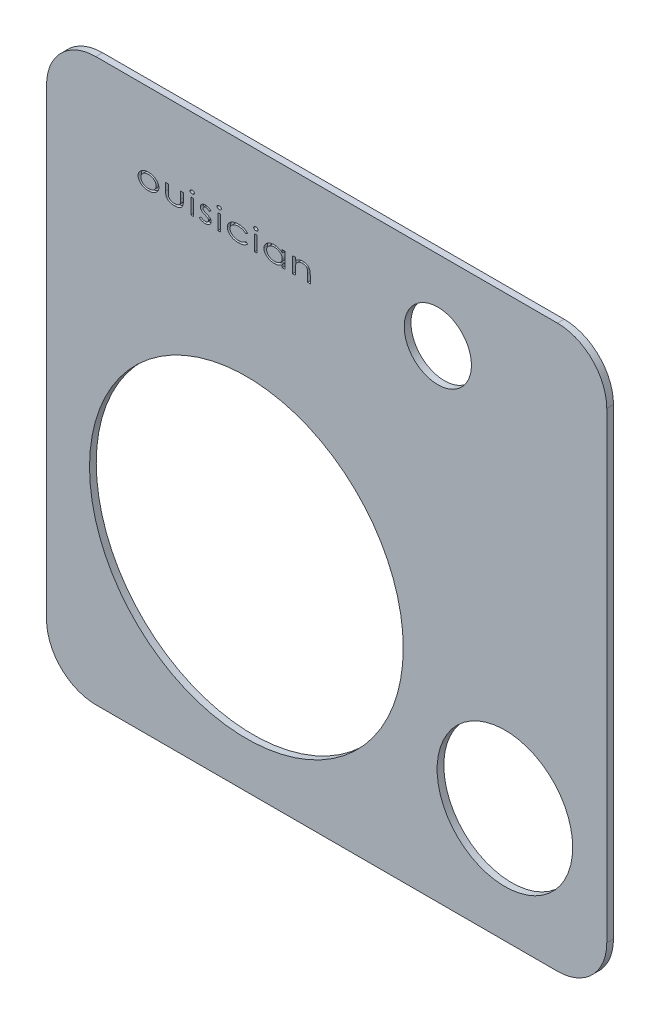
from build123d import *

# Parameters (mm, degrees)
SKETCH1_W           = 500
SKETCH1_H           = 501
BOSS_EXTRUDE1_DEPTH = 6
FILLET1_R           = 44
SKETCH3_R           = 140
CUT_EXTRUDE2_DEPTH  = 708.839671112
SKETCH5_R           = 60.5
CUT_EXTRUDE3_DEPTH  = 708.839671112
SKETCH6_R           = 30
CUT_EXTRUDE5_DEPTH  = 708.839671112
SKETCH7_W           = 2.442307693
SKETCH7_H           = 13.921153846
CUT_EXTRUDE6_DEPTH  = 3


with BuildPart() as part:
    # Sketch1 → Boss-Extrude1 (new body)
    with BuildSketch(Plane.XY):
        with Locations((250, 250.5)):
            Rectangle(SKETCH1_W, SKETCH1_H)
    extrude(amount=BOSS_EXTRUDE1_DEPTH)

    # Fillet1
    fillet1_edges = [part.edges().sort_by_distance(p)[0] for p in [
        (0, 0, 3),
        (500, 0, 3),
        (0, 501, 3),
        (500, 501, 3),
    ]]
    fillet(fillet1_edges, radius=FILLET1_R)

    # Sketch3 → Cut-Extrude2 (cut, through all)
    with BuildSketch(Plane.XY.offset(6)):
        with Locations((178.369044072, 181.034738009)):
            Circle(SKETCH3_R)
    extrude(amount=-CUT_EXTRUDE2_DEPTH, mode=Mode.SUBTRACT)

    # Sketch5 → Cut-Extrude3 (cut, through all)
    with BuildSketch(Plane.XY.offset(6)):
        with Locations((409.103373264, 102.516190165)):
            Circle(SKETCH5_R)
    extrude(amount=-CUT_EXTRUDE3_DEPTH, mode=Mode.SUBTRACT)

    # Sketch6 → Cut-Extrude5 (cut, through all)
    with BuildSketch(Plane.XY.offset(6)):
        with Locations((349.228645131, 430)):
            Circle(SKETCH6_R)
    extrude(amount=-CUT_EXTRUDE5_DEPTH, mode=Mode.SUBTRACT)

    # Sketch7 → Cut-Extrude6 (cut)
    # profile 1 of 12: a face of its own
    with BuildSketch(Plane.XY.offset(6)):
        with BuildLine():
            add(Edge.make_bspline(
                [(90.998016827, 435.165384615), (91.33416584, 435.159759711), (91.993114533, 435.148733283), (92.957647142, 435.033659522), (93.878731764, 434.854379203), (94.758576359, 434.610502452), (95.590807464, 434.281465913), (96.380304595, 433.888600418), (97.127424202, 433.422652341), (97.584251371, 433.055978048), (97.813581731, 432.871905048)],
                knots=[0, 0, 0, 0, 1.097812022, 2.152027136, 3.168404786, 4.161715094, 5.13027777, 6.087458756, 7.039891229, 8, 8, 8, 8], degree=3))
            add(Edge.make_bspline(
                [(97.813581731, 432.871905048), (98.009335824, 432.697597191), (98.392274771, 432.356611897), (98.891710147, 431.793239054), (99.316575043, 431.208138893), (99.66858563, 430.60001305), (99.933961044, 429.962255918), (100.133025282, 429.304789859), (100.249393064, 428.621087473), (100.263850563, 428.156901759), (100.271153846, 427.922415865)],
                knots=[0, 0, 0, 0, 1.100397171, 2.152623868, 3.155292484, 4.134298437, 5.097038208, 6.050627981, 7.015264311, 8, 8, 8, 8], degree=3))
            add(Edge.make_bspline(
                [(100.271153846, 427.922415865), (100.262985923, 427.686557594), (100.246803842, 427.219281241), (100.1202656, 426.531080976), (99.916228441, 425.865485142), (99.63385079, 425.220505043), (99.260671557, 424.60290329), (98.813568578, 424.005599519), (98.279994464, 423.434540306), (97.675345445, 422.891260476), (97.008952386, 422.388722838), (96.285916731, 421.951769806), (95.517972855, 421.581359249), (94.702493985, 421.278996347), (93.842045635, 421.042209306), (92.934251712, 420.875822948), (91.981022296, 420.775452484), (91.330265925, 420.762422035), (90.998016827, 420.755769231)],
                knots=[0, 0, 0, 0, 0.870154496, 1.723927757, 2.573468785, 3.435401244, 4.31551868, 5.231091511, 6.184642541, 7.19533158, 8.228285543, 9.260599047, 10.308491124, 11.370748216, 12.466552481, 13.59834036, 14.773812624, 16, 16, 16, 16], degree=3))
            add(Edge.make_bspline(
                [(90.998016827, 420.755769231), (90.664493287, 420.76241158), (90.011194252, 420.775422478), (89.054210098, 420.875958584), (88.143652313, 421.041541101), (87.281161889, 421.279908639), (86.463621281, 421.580248698), (85.694258277, 421.952957265), (84.96868676, 422.387649146), (84.301792525, 422.890114239), (83.70067732, 423.435825478), (83.167063326, 424.005450714), (82.720132305, 424.602940815), (82.346909523, 425.220495379), (82.064543119, 425.865487666), (81.86050301, 426.531080304), (81.733965548, 427.219281413), (81.717783361, 427.686557652), (81.709615385, 427.922415865)],
                knots=[0, 0, 0, 0, 1.22942661, 2.408175501, 3.543238373, 4.637748882, 5.703147586, 6.749802472, 7.784910086, 8.816644496, 9.822659333, 10.775084556, 11.68957642, 12.568654749, 13.429569571, 14.278107592, 15.130872849, 16, 16, 16, 16], degree=3))
            add(Edge.make_bspline(
                [(81.709615385, 427.922415865), (81.716972911, 428.155627291), (81.731577059, 428.618534746), (81.847825222, 429.300950344), (82.046158974, 429.957402835), (82.311971256, 430.592701804), (82.666655842, 431.197566542), (83.086349343, 431.78522194), (83.590076772, 432.345056297), (83.9717293, 432.685898823), (84.1671875, 432.860456731)],
                knots=[0, 0, 0, 0, 0.981183182, 1.947576142, 2.902902428, 3.862464617, 4.838610501, 5.847446984, 6.897598975, 8, 8, 8, 8], degree=3))
            add(Edge.make_bspline(
                [(84.1671875, 432.860456731), (84.39630701, 433.046103769), (84.852113943, 433.415427217), (85.602419416, 433.880887827), (86.392660465, 434.278984537), (87.228615071, 434.603728856), (88.107303242, 434.856998991), (89.030960896, 435.033027114), (89.999066043, 435.1488953), (90.660580728, 435.159814681), (90.998016827, 435.165384615)],
                knots=[0, 0, 0, 0, 0.960071228, 1.909951369, 2.870129955, 3.839957568, 4.827757854, 5.845479687, 6.900987469, 8, 8, 8, 8], degree=3))
        make_face()
        with BuildLine():
            add(Edge.make_bspline(
                [(90.990384615, 433.455769231), (90.759931849, 433.450534468), (90.306646767, 433.440238042), (89.64046147, 433.36208309), (88.999836122, 433.236197517), (88.382251754, 433.061361552), (87.789245332, 432.830524905), (87.219390762, 432.551855546), (86.673969115, 432.222837228), (86.164894592, 431.842263665), (85.69325583, 431.433077107), (85.283557682, 430.991387268), (84.93262996, 430.533101523), (84.646505842, 430.050473451), (84.42372951, 429.545827573), (84.268203184, 429.018546278), (84.167633357, 428.471957182), (84.157207759, 428.099675328), (84.151923077, 427.910967548)],
                knots=[0, 0, 0, 0, 1.133104166, 2.22873964, 3.293620265, 4.341068313, 5.380791823, 6.418726033, 7.457225619, 8.508179592, 9.540954667, 10.523576707, 11.465678478, 12.37437369, 13.276304193, 14.170872231, 15.072824428, 16, 16, 16, 16], degree=3))
            add(Edge.make_bspline(
                [(84.151923077, 427.910967548), (84.155224854, 427.788754215), (84.161812992, 427.544898117), (84.203563195, 427.182056165), (84.27802016, 426.825417895), (84.375836595, 426.473674907), (84.506467584, 426.129048632), (84.667762202, 425.793044678), (84.856553019, 425.463651622), (85.139556463, 425.031143776), (85.560922859, 424.528710787), (86.143748335, 423.98772249), (86.815372426, 423.530239678), (87.556141514, 423.145742934), (88.355565894, 422.841830349), (89.200613846, 422.626346086), (90.082575005, 422.486306984), (90.684554834, 422.472433101), (90.990384615, 422.465384615)],
                knots=[0, 0, 0, 0, 0.604394602, 1.205967522, 1.803051029, 2.404426593, 3.009606293, 3.622968857, 4.245583361, 4.885868639, 6.176917373, 7.476808435, 8.806374189, 10.182172105, 11.595745519, 13.025309634, 14.488738556, 16, 16, 16, 16], degree=3))
            add(Edge.make_bspline(
                [(90.990384615, 422.465384615), (91.296214397, 422.472433101), (91.898194226, 422.486306984), (92.780155384, 422.626346086), (93.625203337, 422.841830349), (94.424627717, 423.145742934), (95.165396804, 423.530239678), (95.837020896, 423.98772249), (96.419846372, 424.528710787), (96.841212768, 425.031143776), (97.124216212, 425.463651622), (97.313007029, 425.793044678), (97.474301647, 426.129048632), (97.604932636, 426.473674907), (97.702749071, 426.825417895), (97.777206036, 427.182056165), (97.818956239, 427.544898117), (97.825544377, 427.788754215), (97.828846154, 427.910967548)],
                knots=[0, 0, 0, 0, 1.511261444, 2.974690366, 4.404254481, 5.817827895, 7.193625811, 8.523191565, 9.823082627, 11.114131361, 11.754416639, 12.377031143, 12.990393707, 13.595573407, 14.196948971, 14.794032478, 15.395605398, 16, 16, 16, 16], degree=3))
            add(Edge.make_bspline(
                [(97.828846154, 427.910967548), (97.823452117, 428.099642599), (97.812810784, 428.471859884), (97.713755046, 429.019286123), (97.55211788, 429.545126634), (97.330631709, 430.050461339), (97.044469717, 430.534191041), (96.689373839, 430.991480617), (96.276061842, 431.431800742), (95.80425835, 431.843696561), (95.291927228, 432.221694495), (94.747024468, 432.551047596), (94.180153014, 432.830509923), (93.589871882, 433.062042926), (92.97326866, 433.23612774), (92.3339133, 433.361749711), (91.670324915, 433.440292096), (91.219569094, 433.450552421), (90.990384615, 433.455769231)],
                knots=[0, 0, 0, 0, 0.927697335, 1.8301571, 2.727043116, 3.629481175, 4.53868775, 5.485114823, 6.472564047, 7.50592031, 8.562501804, 9.6015858, 10.634487024, 11.668961074, 12.716998568, 13.782478447, 14.872512573, 16, 16, 16, 16], degree=3))
        make_face(mode=Mode.SUBTRACT)
    # profile 2 of 12: a face of its own
    with BuildSketch(Plane.XY.offset(6)):
        with BuildLine():
            Line((106.230384615, 434.921153846), (108.672692308, 434.921153846))
            Line((108.672692308, 434.921153846), (108.672692308, 428.464302885))
            add(Edge.make_bspline(
                [(108.672692308, 428.464302885), (108.67304883, 428.274758065), (108.673730903, 427.912134977), (108.689179922, 427.390435007), (108.71483796, 426.914440569), (108.752763418, 426.48432833), (108.799227595, 426.100114671), (108.848337784, 425.761383245), (108.917599286, 425.468541446), (108.974426823, 425.291547247), (109.000877404, 425.209164663)],
                knots=[0, 0, 0, 0, 1.385077091, 2.649826742, 3.813598512, 4.868107529, 5.804337452, 6.641819815, 7.36783017, 8, 8, 8, 8], degree=3))
            add(Edge.make_bspline(
                [(109.000877404, 425.209164663), (109.044396837, 425.105013689), (109.131457854, 424.89665873), (109.302351854, 424.605330313), (109.49296631, 424.324528659), (109.720840579, 424.068626446), (109.968064185, 423.820383849), (110.249733903, 423.596945348), (110.554561365, 423.385778183), (110.887454185, 423.196455381), (111.241314974, 423.02415608), (111.616312247, 422.877608341), (112.004793861, 422.745441215), (112.412263948, 422.643536904), (112.835357602, 422.56362575), (113.276208104, 422.506717165), (113.733549443, 422.471746404), (114.044434162, 422.467526505), (114.202229567, 422.465384615)],
                knots=[0, 0, 0, 0, 0.866612738, 1.733666556, 2.590685396, 3.470868852, 4.362703729, 5.280369739, 6.229525244, 7.210572352, 8.220662861, 9.251871877, 10.303048293, 11.372479967, 12.476955404, 13.610811224, 14.787322159, 16, 16, 16, 16], degree=3))
            add(Edge.make_bspline(
                [(114.202229567, 422.465384615), (114.360047034, 422.467321614), (114.668437768, 422.471106697), (115.121529256, 422.508412125), (115.558051177, 422.558263522), (115.975214872, 422.640541518), (116.376725011, 422.73760143), (116.756598145, 422.865485943), (117.121193965, 423.008919171), (117.464616192, 423.178005547), (117.785912311, 423.362768316), (118.084379061, 423.562646818), (118.353661803, 423.779894427), (118.599121729, 424.009015161), (118.819786565, 424.251982321), (119.013477372, 424.509527551), (119.179929009, 424.783717686), (119.270404247, 424.975523005), (119.315811298, 425.071784856)],
                knots=[0, 0, 0, 0, 1.247675426, 2.438079564, 3.593415261, 4.71988351, 5.798211008, 6.857462447, 7.88667594, 8.894380439, 9.881286462, 10.815903603, 11.731765806, 12.614206242, 13.468803136, 14.323814323, 15.158768193, 16, 16, 16, 16], degree=3))
            add(Edge.make_bspline(
                [(119.315811298, 425.071784856), (119.343772918, 425.147698715), (119.405340224, 425.314849678), (119.476730526, 425.599550008), (119.530071073, 425.940878789), (119.5804617, 426.337785098), (119.617199664, 426.79110054), (119.641939384, 427.300193793), (119.663410407, 427.863728416), (119.663191362, 428.258209148), (119.663076923, 428.464302885)],
                knots=[0, 0, 0, 0, 0.566488682, 1.247323346, 2.051625098, 2.985625027, 4.049821468, 5.236680496, 6.55632279, 8, 8, 8, 8], degree=3))
            Line((119.663076923, 428.464302885), (119.663076923, 434.921153846))
            Line((119.663076923, 434.921153846), (122.105384615, 434.921153846))
            Line((122.105384615, 434.921153846), (122.105384615, 428.14375))
            add(Edge.make_bspline(
                [(122.105384615, 428.14375), (122.10188359, 427.913473618), (122.095089428, 427.46659457), (122.059102897, 426.816810981), (121.990445822, 426.21183682), (121.89664572, 425.64919923), (121.770629204, 425.133428868), (121.623724758, 424.658446652), (121.443720876, 424.229647499), (121.236609016, 423.839962269), (120.9990053, 423.485020596), (120.738952038, 423.15197922), (120.451735425, 422.836864157), (120.13363067, 422.544017657), (119.79071582, 422.267783774), (119.416733508, 422.01711793), (119.02051862, 421.777890149), (118.592199109, 421.565635423), (118.136961426, 421.375301021), (117.655354507, 421.204614588), (117.143608619, 421.071335258), (116.605290427, 420.955061697), (116.039728501, 420.864501807), (115.444977191, 420.799930907), (114.82350722, 420.761223008), (114.399451428, 420.757611426), (114.183149038, 420.755769231)],
                knots=[0, 0, 0, 0, 1.327493148, 2.576160298, 3.749463019, 4.83557823, 5.861724984, 6.807863683, 7.698474281, 8.538253159, 9.347648041, 10.157308583, 10.972132152, 11.802284539, 12.647392361, 13.507664376, 14.395463419, 15.313628384, 16.260079569, 17.238676909, 18.256062574, 19.305906206, 20.412519666, 21.555860972, 22.753293505, 24, 24, 24, 24], degree=3))
            add(Edge.make_bspline(
                [(114.183149038, 420.755769231), (113.966846296, 420.757609672), (113.542789811, 420.761217815), (112.921324803, 420.799950352), (112.326555797, 420.864433403), (111.759827373, 420.95550049), (111.218890889, 421.071303579), (110.703357091, 421.20462846), (110.217947609, 421.375324522), (109.758843809, 421.56556743), (109.326943065, 421.778130381), (108.925523545, 422.01660401), (108.550740752, 422.271149014), (108.204505771, 422.547512404), (107.887831793, 422.845874707), (107.596887939, 423.163375914), (107.332574978, 423.49918716), (107.095924088, 423.859441096), (106.886206517, 424.252546491), (106.713093959, 424.693011378), (106.560142763, 425.175702663), (106.439395048, 425.70698293), (106.345797763, 426.281877458), (106.276277334, 426.903320211), (106.24070314, 427.570917129), (106.233897734, 428.031775198), (106.230384615, 428.26968149)],
                knots=[0, 0, 0, 0, 1.232259487, 2.415816005, 3.545908112, 4.639697982, 5.684463563, 6.697060633, 7.671163045, 8.61333243, 9.52734564, 10.411089718, 11.271463884, 12.106778478, 12.932257128, 13.747877815, 14.558330161, 15.364395943, 16.200841634, 17.09177784, 18.056778823, 19.083464923, 20.192728377, 21.374041605, 22.644415561, 24, 24, 24, 24], degree=3))
            Line((106.230384615, 428.26968149), (106.230384615, 434.921153846))
        make_face()
    # profile 3 of 12: a face of its own
    with BuildSketch(Plane.XY.offset(6)):
        with BuildLine():
            add(Edge.make_bspline(
                [(130.010829327, 440.782692308), (130.142275672, 440.777937971), (130.396357018, 440.768748), (130.76327945, 440.686757813), (131.097698684, 440.547623283), (131.396736208, 440.362412802), (131.651360243, 440.142140023), (131.833210732, 439.884784611), (131.955432976, 439.606151579), (131.966662641, 439.408854792), (131.972307692, 439.309675481)],
                knots=[0, 0, 0, 0, 1.162518104, 2.247108227, 3.30734103, 4.354153766, 5.351019781, 6.263407083, 7.127030435, 8, 8, 8, 8], degree=3))
            add(Edge.make_bspline(
                [(131.972307692, 439.309675481), (131.966499241, 439.213063095), (131.954864551, 439.019542472), (131.833188079, 438.745712049), (131.650028987, 438.492215413), (131.396896141, 438.272078398), (131.09765438, 438.087026503), (130.763291605, 437.947848133), (130.396353693, 437.865869967), (130.142274539, 437.856678294), (130.010829327, 437.851923077)],
                knots=[0, 0, 0, 0, 0.855086126, 1.712790746, 2.620787936, 3.622906021, 4.675233975, 5.741052701, 6.831357075, 8, 8, 8, 8], degree=3))
            add(Edge.make_bspline(
                [(130.010829327, 437.851923077), (129.881915107, 437.856716122), (129.631600287, 437.866022855), (129.268734697, 437.948559671), (128.93535211, 438.086906264), (128.636532447, 438.272322218), (128.382561323, 438.49094553), (128.204245252, 438.746985149), (128.081859472, 439.019399786), (128.070357552, 439.213015582), (128.064615385, 439.309675481)],
                knots=[0, 0, 0, 0, 1.151846764, 2.236559441, 3.307763338, 4.3654083, 5.372589701, 6.278555182, 7.140593453, 8, 8, 8, 8], degree=3))
            add(Edge.make_bspline(
                [(128.064615385, 439.309675481), (128.070191716, 439.408903308), (128.081284678, 439.606296605), (128.204241083, 439.883517896), (128.381225954, 440.143392482), (128.636691086, 440.362173241), (128.93530815, 440.547742354), (129.268746625, 440.686046697), (129.631597072, 440.76859496), (129.881914014, 440.777900089), (130.010829327, 440.782692308)],
                knots=[0, 0, 0, 0, 0.877349818, 1.745306527, 2.655753819, 3.657621755, 4.709687028, 5.775239705, 6.854229894, 8, 8, 8, 8], degree=3))
        make_face()
    # profile 4 of 12: a face of its own
    with BuildSketch(Plane.XY.offset(6)):
        with Locations((130.018461538, 427.960576923)):
            Rectangle(SKETCH7_W, SKETCH7_H)
    # profile 5 of 12: a face of its own
    with BuildSketch(Plane.XY.offset(6)):
        with BuildLine():
            Line((146.723846154, 433.184825721), (145.243197115, 431.990384615))
            add(Edge.make_bspline(
                [(145.243197115, 431.990384615), (145.108628672, 432.106763221), (144.847395732, 432.332684874), (144.441444074, 432.630615625), (144.039666988, 432.885467943), (143.637692732, 433.093193211), (143.23744572, 433.253614732), (142.840393482, 433.37029618), (142.444806594, 433.442307965), (142.180425116, 433.451302151), (142.049116587, 433.455769231)],
                knots=[0, 0, 0, 0, 1.187891683, 2.306011931, 3.359687364, 4.362827326, 5.323627033, 6.235078112, 7.123428389, 8, 8, 8, 8], degree=3))
            add(Edge.make_bspline(
                [(142.049116587, 433.455769231), (141.88943601, 433.449945771), (141.577709682, 433.438577291), (141.128995906, 433.326872444), (140.713267851, 433.150766049), (140.345337389, 432.905062278), (140.038258864, 432.616440153), (139.805822686, 432.29831267), (139.669043675, 431.947304627), (139.650466068, 431.704013529), (139.641153846, 431.582061298)],
                knots=[0, 0, 0, 0, 1.136790661, 2.219227826, 3.275698873, 4.342400822, 5.356146276, 6.26721311, 7.131422276, 8, 8, 8, 8], degree=3))
            add(Edge.make_bspline(
                [(139.641153846, 431.582061298), (139.648072393, 431.471452953), (139.662070966, 431.247654641), (139.794066286, 430.924230965), (139.985155852, 430.604175005), (140.164740257, 430.417361836), (140.259362981, 430.318930288)],
                knots=[0, 0, 0, 0, 0.915738981, 1.852851503, 2.868671037, 4, 4, 4, 4], degree=3))
            add(Edge.make_bspline(
                [(140.259362981, 430.318930288), (140.316841401, 430.265517349), (140.440363823, 430.150731739), (140.66312168, 429.993460246), (140.920459986, 429.820508005), (141.225172814, 429.645990606), (141.570115779, 429.464031564), (141.959672002, 429.277397098), (142.388201797, 429.078072731), (142.692309228, 428.950457156), (142.850498798, 428.884074519)],
                knots=[0, 0, 0, 0, 0.632188666, 1.358587701, 2.195162106, 3.133051463, 4.188584517, 5.34030249, 6.616487589, 8, 8, 8, 8], degree=3))
            add(Edge.make_bspline(
                [(142.850498798, 428.884074519), (143.04296664, 428.801013778), (143.414650097, 428.640611379), (143.945604946, 428.39429755), (144.426097499, 428.145980586), (144.860029442, 427.902099996), (145.244949252, 427.659060334), (145.583279447, 427.417959056), (145.875366745, 427.180598894), (146.042124055, 427.010557281), (146.120901442, 426.930228365)],
                knots=[0, 0, 0, 0, 1.312067257, 2.53379313, 3.662611409, 4.696582447, 5.648584007, 6.510270476, 7.296240754, 8, 8, 8, 8], degree=3))
            add(Edge.make_bspline(
                [(146.120901442, 426.930228365), (146.250410726, 426.770307261), (146.503368843, 426.457948639), (146.773683212, 425.925723143), (146.937354613, 425.361293915), (146.957770095, 424.973648741), (146.968076923, 424.777944712)],
                knots=[0, 0, 0, 0, 1.042010882, 2.035260359, 3.008094284, 4, 4, 4, 4], degree=3))
            add(Edge.make_bspline(
                [(146.968076923, 424.777944712), (146.964160216, 424.640212988), (146.956415343, 424.367863096), (146.879962019, 423.968350848), (146.762725852, 423.584773686), (146.595269524, 423.217216054), (146.381649227, 422.864953358), (146.114371419, 422.532222976), (145.803257715, 422.214685535), (145.450235365, 421.914599027), (145.060996691, 421.643924393), (144.645927454, 421.403850568), (144.203991097, 421.205784778), (143.738878897, 421.043085138), (143.250886535, 420.911079666), (142.738780109, 420.821021467), (142.202918307, 420.767203493), (141.838084999, 420.759628087), (141.652241587, 420.755769231)],
                knots=[0, 0, 0, 0, 0.892205618, 1.764242088, 2.627811223, 3.487946356, 4.376330948, 5.292242552, 6.248848694, 7.255361655, 8.291945272, 9.319133229, 10.360170501, 11.427157011, 12.511599973, 13.634479513, 14.795021201, 16, 16, 16, 16], degree=3))
            add(Edge.make_bspline(
                [(141.652241587, 420.755769231), (141.401325968, 420.761150339), (140.9040019, 420.771815894), (140.167509533, 420.872072852), (139.448568694, 421.027432213), (138.753452925, 421.243527882), (138.09583852, 421.515382218), (137.491610634, 421.84054419), (136.942403927, 422.208409779), (136.623218349, 422.498284321), (136.466153846, 422.640925481)],
                knots=[0, 0, 0, 0, 1.065567263, 2.111993857, 3.151924496, 4.187816772, 5.200540087, 6.170180221, 7.099584209, 8, 8, 8, 8], degree=3))
            Line((136.466153846, 422.640925481), (137.912457933, 423.930769231))
            add(Edge.make_bspline(
                [(137.912457933, 423.930769231), (138.049401765, 423.814141274), (138.31698632, 423.58625339), (138.739286411, 423.287234694), (139.167745402, 423.033568285), (139.604428976, 422.82608708), (140.047956837, 422.665218183), (140.49765394, 422.549894119), (140.95288379, 422.47866515), (141.2589323, 422.469808959), (141.411826923, 422.465384615)],
                knots=[0, 0, 0, 0, 1.111927383, 2.17267613, 3.195288797, 4.187559573, 5.158013992, 6.108138625, 7.054870644, 8, 8, 8, 8], degree=3))
            add(Edge.make_bspline(
                [(141.411826923, 422.465384615), (141.619890822, 422.472826451), (142.024802502, 422.487308954), (142.606413862, 422.617658046), (143.142957818, 422.822298186), (143.541873457, 423.070291073), (143.82465384, 423.299002153), (144.015490095, 423.473508321), (144.172511869, 423.661343189), (144.298588345, 423.857235792), (144.399742655, 424.057631559), (144.47428417, 424.266031474), (144.515814487, 424.483732734), (144.522449345, 424.631500227), (144.525769231, 424.705438702)],
                knots=[0, 0, 0, 0, 1.769049331, 3.442734361, 5.047389919, 6.63714271, 7.415058499, 8.142822723, 8.83465713, 9.492434366, 10.121975348, 10.74185, 11.370459018, 12, 12, 12, 12], degree=3))
            add(Edge.make_bspline(
                [(144.525769231, 424.705438702), (144.518589932, 424.827239828), (144.504280678, 425.070004948), (144.382682589, 425.420139458), (144.18808649, 425.749184081), (144.008453161, 425.936298614), (143.915192308, 426.03344351)],
                knots=[0, 0, 0, 0, 0.970537225, 1.934404011, 2.927597426, 4, 4, 4, 4], degree=3))
            add(Edge.make_bspline(
                [(143.915192308, 426.03344351), (143.857478859, 426.08281122), (143.730269214, 426.191625526), (143.502295165, 426.345603239), (143.229305301, 426.511416708), (142.90957287, 426.689310501), (142.540153261, 426.869551374), (142.122330299, 427.06059262), (141.657553479, 427.261946059), (141.33061169, 427.397530684), (141.159963942, 427.468299279)],
                knots=[0, 0, 0, 0, 0.584112892, 1.287477956, 2.113538331, 3.042533919, 4.102045882, 5.276041122, 6.578225652, 8, 8, 8, 8], degree=3))
            add(Edge.make_bspline(
                [(141.159963942, 427.468299279), (140.974888583, 427.547022059), (140.618588464, 427.698576193), (140.112737184, 427.940851347), (139.65230236, 428.180609063), (139.234749093, 428.414593383), (138.866531445, 428.65350503), (138.541352056, 428.886970822), (138.264158897, 429.124522811), (138.103428064, 429.289982618), (138.026941106, 429.368719952)],
                knots=[0, 0, 0, 0, 1.307990047, 2.518093226, 3.646744414, 4.68422955, 5.629722174, 6.500166002, 7.286274211, 8, 8, 8, 8], degree=3))
            add(Edge.make_bspline(
                [(138.026941106, 429.368719952), (137.899583678, 429.525931958), (137.649407773, 429.834753019), (137.390801903, 430.365999149), (137.229391014, 430.928979565), (137.209142808, 431.316373266), (137.198846154, 431.513371394)],
                knots=[0, 0, 0, 0, 1.030481179, 2.024236566, 2.995281297, 4, 4, 4, 4], degree=3))
            add(Edge.make_bspline(
                [(137.198846154, 431.513371394), (137.201583677, 431.6421907), (137.206960452, 431.895205009), (137.277097059, 432.264460354), (137.377416385, 432.619720207), (137.528901436, 432.955320929), (137.717508039, 433.275812463), (137.948718775, 433.579932737), (138.224562285, 433.864562947), (138.537865553, 434.131231943), (138.881954837, 434.374181038), (139.254097465, 434.583196948), (139.645558113, 434.764002372), (140.058818934, 434.913439691), (140.495680672, 435.028035421), (140.955494367, 435.106084144), (141.436073409, 435.158081049), (141.764039624, 435.16292259), (141.930817308, 435.165384615)],
                knots=[0, 0, 0, 0, 0.926970618, 1.820665221, 2.699569755, 3.581909386, 4.465438636, 5.374792027, 6.327820406, 7.316125139, 8.33593867, 9.358097786, 10.387588118, 11.440163339, 12.520745957, 13.63746689, 14.798602476, 16, 16, 16, 16], degree=3))
            add(Edge.make_bspline(
                [(141.930817308, 435.165384615), (142.1295673, 435.159294322), (142.53039937, 435.14701163), (143.130696064, 435.053055289), (143.730290421, 434.893447596), (144.33062339, 434.675258452), (144.932036704, 434.393482642), (145.534542597, 434.053651495), (146.138077188, 433.650548912), (146.525022778, 433.342902817), (146.723846154, 433.184825721)],
                knots=[0, 0, 0, 0, 0.90139979, 1.817911729, 2.748700527, 3.712549689, 4.711683986, 5.758141166, 6.848070756, 8, 8, 8, 8], degree=3))
        make_face()
    # profile 6 of 12: a face of its own
    with BuildSketch(Plane.XY.offset(6)):
        with BuildLine():
            add(Edge.make_bspline(
                [(154.140829327, 440.782692308), (154.272275672, 440.777937971), (154.526357018, 440.768748), (154.89327945, 440.686757813), (155.227698684, 440.547623283), (155.526736208, 440.362412802), (155.781360243, 440.142140023), (155.963210732, 439.884784611), (156.085432976, 439.606151579), (156.096662641, 439.408854792), (156.102307692, 439.309675481)],
                knots=[0, 0, 0, 0, 1.162518104, 2.247108227, 3.30734103, 4.354153766, 5.351019781, 6.263407083, 7.127030435, 8, 8, 8, 8], degree=3))
            add(Edge.make_bspline(
                [(156.102307692, 439.309675481), (156.096499241, 439.213063095), (156.084864551, 439.019542472), (155.963188079, 438.745712049), (155.780028987, 438.492215413), (155.526896141, 438.272078398), (155.22765438, 438.087026503), (154.893291605, 437.947848133), (154.526353693, 437.865869967), (154.272274539, 437.856678294), (154.140829327, 437.851923077)],
                knots=[0, 0, 0, 0, 0.855086126, 1.712790746, 2.620787936, 3.622906021, 4.675233975, 5.741052701, 6.831357075, 8, 8, 8, 8], degree=3))
            add(Edge.make_bspline(
                [(154.140829327, 437.851923077), (154.011915107, 437.856716122), (153.761600287, 437.866022855), (153.398734697, 437.948559671), (153.06535211, 438.086906264), (152.766532447, 438.272322218), (152.512561323, 438.49094553), (152.334245252, 438.746985149), (152.211859472, 439.019399786), (152.200357552, 439.213015582), (152.194615385, 439.309675481)],
                knots=[0, 0, 0, 0, 1.151846764, 2.236559441, 3.307763338, 4.3654083, 5.372589701, 6.278555182, 7.140593453, 8, 8, 8, 8], degree=3))
            add(Edge.make_bspline(
                [(152.194615385, 439.309675481), (152.200191716, 439.408903308), (152.211284678, 439.606296605), (152.334241083, 439.883517896), (152.511225954, 440.143392482), (152.766691086, 440.362173241), (153.06530815, 440.547742354), (153.398746625, 440.686046697), (153.761597072, 440.76859496), (154.011914014, 440.777900089), (154.140829327, 440.782692308)],
                knots=[0, 0, 0, 0, 0.877349818, 1.745306527, 2.655753819, 3.657621755, 4.709687028, 5.775239705, 6.854229894, 8, 8, 8, 8], degree=3))
        make_face()
    # profile 7 of 12: a face of its own
    with BuildSketch(Plane.XY.offset(6)):
        with Locations((154.148461538, 427.960576923)):
            Rectangle(SKETCH7_W, SKETCH7_H)
    # profile 8 of 12: a face of its own
    with BuildSketch(Plane.XY.offset(6)):
        with BuildLine():
            Line((179.646153846, 431.902614183), (177.818239183, 431.013461538))
            add(Edge.make_bspline(
                [(177.818239183, 431.013461538), (177.616463475, 431.209191833), (177.214716671, 431.598901878), (176.534857698, 432.096073331), (175.803439979, 432.516570304), (175.018283836, 432.862996456), (174.179774658, 433.128648407), (173.287892021, 433.318953468), (172.342659801, 433.435166006), (171.693727947, 433.448791275), (171.361388221, 433.455769231)],
                knots=[0, 0, 0, 0, 0.9494826, 1.890473355, 2.83836709, 3.797269736, 4.786037081, 5.806678462, 6.876726617, 8, 8, 8, 8], degree=3))
            add(Edge.make_bspline(
                [(171.361388221, 433.455769231), (171.094116797, 433.450148963), (170.571297039, 433.439154944), (169.803106282, 433.36738343), (169.07159153, 433.24047387), (168.371311289, 433.070212975), (167.707255395, 432.845447982), (167.079181101, 432.568365173), (166.482728148, 432.248628267), (165.931296905, 431.875181611), (165.425332792, 431.472348195), (164.984520779, 431.039777262), (164.609021152, 430.5876644), (164.306048295, 430.110959886), (164.06630352, 429.614455729), (163.89188632, 429.095997531), (163.791715707, 428.553396873), (163.778053395, 428.184854224), (163.771153846, 427.998737981)],
                knots=[0, 0, 0, 0, 1.238220852, 2.42213071, 3.570180525, 4.675007234, 5.757735811, 6.813227596, 7.852154922, 8.888387926, 9.894317433, 10.84442819, 11.744594942, 12.611028748, 13.4544716, 14.293062589, 15.137986393, 16, 16, 16, 16], degree=3))
            add(Edge.make_bspline(
                [(163.771153846, 427.998737981), (163.774173618, 427.87650142), (163.780202841, 427.63244609), (163.826414017, 427.268033372), (163.907917263, 426.911448671), (164.014761672, 426.558205723), (164.157394606, 426.213777907), (164.325277393, 425.870371783), (164.528404494, 425.535555355), (164.761373163, 425.208561131), (165.018919627, 424.891179701), (165.307530423, 424.595594756), (165.612123721, 424.311237301), (165.941931043, 424.046388761), (166.296961857, 423.804452903), (166.672697281, 423.576185969), (167.074033991, 423.373325661), (167.637366155, 423.114658241), (168.388361176, 422.851171428), (169.338714115, 422.627116485), (170.3411086, 422.491148963), (171.026413387, 422.474098572), (171.376652644, 422.465384615)],
                knots=[0, 0, 0, 0, 0.703448363, 1.404492419, 2.109653125, 2.806710023, 3.525907214, 4.252777145, 5.00487144, 5.776801811, 6.562360393, 7.354577522, 8.152424161, 8.959654607, 9.786176278, 10.623650001, 11.488082903, 12.372711049, 14.190457285, 16.056797813, 17.984744556, 20, 20, 20, 20], degree=3))
            add(Edge.make_bspline(
                [(171.376652644, 422.465384615), (171.698841389, 422.472310415), (172.328801913, 422.485852105), (173.250876926, 422.603728641), (174.127754821, 422.792604008), (174.960165477, 423.060514825), (175.747296935, 423.404710654), (176.487329863, 423.828993337), (177.187966428, 424.322251154), (177.607431052, 424.71187906), (177.818239183, 424.907692308)],
                knots=[0, 0, 0, 0, 1.093058425, 2.137205815, 3.149093137, 4.13342061, 5.099941104, 6.058950921, 7.024497173, 8, 8, 8, 8], degree=3))
            Line((177.818239183, 424.907692308), (179.646153846, 423.968930288))
            add(Edge.make_bspline(
                [(179.646153846, 423.968930288), (179.536045182, 423.843800775), (179.314149189, 423.591634084), (178.946512602, 423.243953894), (178.556389212, 422.912098501), (178.133850866, 422.607176984), (177.685100181, 422.322104138), (177.208409271, 422.057378457), (176.705459459, 421.813388284), (176.17492945, 421.593196648), (175.622571805, 421.394562369), (175.049236329, 421.22299936), (174.458105457, 421.078607349), (173.848217457, 420.959648985), (173.219041554, 420.868304909), (172.570752416, 420.805857249), (171.903932229, 420.759867265), (171.45305761, 420.757149755), (171.224008413, 420.755769231)],
                knots=[0, 0, 0, 0, 0.860018317, 1.733148069, 2.609235921, 3.502384109, 4.420505129, 5.352331597, 6.315625453, 7.304649951, 8.316176708, 9.34452958, 10.392486919, 11.456228468, 12.551111855, 13.672994075, 14.817855754, 16, 16, 16, 16], degree=3))
            add(Edge.make_bspline(
                [(171.224008413, 420.755769231), (170.87519616, 420.760630704), (170.19135258, 420.770161583), (169.189586881, 420.874379486), (168.233504377, 421.030533673), (167.32281303, 421.258043278), (166.456278922, 421.545614524), (165.635398275, 421.902413074), (164.860847741, 422.322969492), (164.141397922, 422.806024942), (163.483155818, 423.328801201), (162.912797632, 423.893833331), (162.421277402, 424.479060575), (162.019265874, 425.096653648), (161.714430178, 425.746786448), (161.487840592, 426.420478834), (161.356629112, 427.124857594), (161.338176519, 427.60388063), (161.328846154, 427.84609375)],
                knots=[0, 0, 0, 0, 1.240348237, 2.431692603, 3.578767869, 4.683897599, 5.767086738, 6.822899822, 7.863663898, 8.897767126, 9.901946174, 10.849043619, 11.748780218, 12.616061319, 13.462118978, 14.296332513, 15.138557887, 16, 16, 16, 16], degree=3))
            add(Edge.make_bspline(
                [(161.328846154, 427.84609375), (161.33164837, 428.0104617), (161.337231874, 428.337970071), (161.408997866, 428.823128218), (161.502735878, 429.302516524), (161.652867897, 429.76909962), (161.833855007, 430.230779678), (162.066167303, 430.678049256), (162.32902325, 431.122434333), (162.639545796, 431.549197563), (162.979253879, 431.966415166), (163.361597782, 432.353197645), (163.764075994, 432.727687252), (164.205605941, 433.068091791), (164.672575682, 433.392183447), (165.172849643, 433.687193548), (165.701783635, 433.96442585), (166.260574219, 434.213842531), (166.842514661, 434.438535186), (167.443706523, 434.63373098), (168.06282616, 434.798225557), (168.700309634, 434.929478861), (169.352818221, 435.039374843), (170.023351183, 435.108368567), (170.709384472, 435.157177359), (171.173037193, 435.162630688), (171.40718149, 435.165384615)],
                knots=[0, 0, 0, 0, 0.856107378, 1.705821189, 2.552501917, 3.399883552, 4.256966376, 5.134834285, 6.024198899, 6.946193713, 7.883585536, 8.826217102, 9.779057133, 10.74746224, 11.729732201, 12.740793126, 13.773010902, 14.841590098, 15.92903673, 17.02373846, 18.135243946, 19.266767217, 20.415857255, 21.583191723, 22.779513524, 24, 24, 24, 24], degree=3))
            add(Edge.make_bspline(
                [(171.40718149, 435.165384615), (171.702493048, 435.160428662), (172.289120434, 435.150583813), (173.159237987, 435.066314117), (174.015298331, 434.939452022), (174.84648643, 434.75149307), (175.640117402, 434.525605816), (176.380642007, 434.267412605), (177.056757181, 433.974176675), (177.674574688, 433.648556089), (178.238119677, 433.282259197), (178.756294734, 432.873167646), (179.229331086, 432.413570755), (179.506871615, 432.073351432), (179.646153846, 431.902614183)],
                knots=[0, 0, 0, 0, 1.160203264, 2.304708337, 3.432278024, 4.558916641, 5.650627656, 6.673486115, 7.638332717, 8.543962861, 9.414652643, 10.275718857, 11.134678723, 12, 12, 12, 12], degree=3))
        make_face()
    # profile 9 of 12: a face of its own
    with BuildSketch(Plane.XY.offset(6)):
        with BuildLine():
            add(Edge.make_bspline(
                [(186.81890625, 440.782692308), (186.950352595, 440.777937971), (187.204433941, 440.768748), (187.571356373, 440.686757813), (187.905775607, 440.547623283), (188.204813131, 440.362412802), (188.459437166, 440.142140023), (188.641287656, 439.884784611), (188.763509899, 439.606151579), (188.774739564, 439.408854792), (188.780384615, 439.309675481)],
                knots=[0, 0, 0, 0, 1.162518104, 2.247108227, 3.30734103, 4.354153766, 5.351019781, 6.263407083, 7.127030435, 8, 8, 8, 8], degree=3))
            add(Edge.make_bspline(
                [(188.780384615, 439.309675481), (188.774576164, 439.213063095), (188.762941474, 439.019542472), (188.641265002, 438.745712049), (188.45810591, 438.492215413), (188.204973064, 438.272078398), (187.905731303, 438.087026503), (187.571368528, 437.947848133), (187.204430616, 437.865869967), (186.950351462, 437.856678294), (186.81890625, 437.851923077)],
                knots=[0, 0, 0, 0, 0.855086126, 1.712790746, 2.620787936, 3.622906021, 4.675233975, 5.741052701, 6.831357075, 8, 8, 8, 8], degree=3))
            add(Edge.make_bspline(
                [(186.81890625, 437.851923077), (186.68999203, 437.856716122), (186.43967721, 437.866022855), (186.07681162, 437.948559671), (185.743429033, 438.086906264), (185.44460937, 438.272322218), (185.190638246, 438.49094553), (185.012322175, 438.746985149), (184.889936395, 439.019399786), (184.878434475, 439.213015582), (184.872692308, 439.309675481)],
                knots=[0, 0, 0, 0, 1.151846764, 2.236559441, 3.307763338, 4.3654083, 5.372589701, 6.278555182, 7.140593453, 8, 8, 8, 8], degree=3))
            add(Edge.make_bspline(
                [(184.872692308, 439.309675481), (184.878268639, 439.408903308), (184.889361601, 439.606296605), (185.012318006, 439.883517896), (185.189302877, 440.143392482), (185.444768009, 440.362173241), (185.743385073, 440.547742354), (186.076823548, 440.686046697), (186.439673995, 440.76859496), (186.689990937, 440.777900089), (186.81890625, 440.782692308)],
                knots=[0, 0, 0, 0, 0.877349818, 1.745306527, 2.655753819, 3.657621755, 4.709687028, 5.775239705, 6.854229894, 8, 8, 8, 8], degree=3))
        make_face()
    # profile 10 of 12: a face of its own
    with BuildSketch(Plane.XY.offset(6)):
        with Locations((186.826538462, 427.960576923)):
            Rectangle(SKETCH7_W, SKETCH7_H)
    # profile 11 of 12: a face of its own
    with BuildSketch(Plane.XY.offset(6)):
        with BuildLine():
            Line((212.812692308, 434.921153846), (212.812692308, 421))
            Line((212.812692308, 421), (210.370384615, 421))
            Line((210.370384615, 421), (210.370384615, 423.40796274))
            add(Edge.make_bspline(
                [(210.370384615, 423.40796274), (210.126851918, 423.18870648), (209.644733221, 422.754647549), (208.847249274, 422.205173464), (208.008666265, 421.744184083), (207.125208156, 421.376649012), (206.198786539, 421.097686487), (205.231443398, 420.902845649), (204.222270405, 420.774317407), (203.534873397, 420.762029626), (203.184657452, 420.755769231)],
                knots=[0, 0, 0, 0, 1.000186988, 1.98005792, 2.950451851, 3.918937695, 4.897459287, 5.901142758, 6.930671412, 8, 8, 8, 8], degree=3))
            add(Edge.make_bspline(
                [(203.184657452, 420.755769231), (202.874016515, 420.762482472), (202.261307141, 420.775723695), (201.360469143, 420.876952976), (200.494001296, 421.04055978), (199.661978116, 421.268747952), (198.865814535, 421.568169894), (198.103509491, 421.931848112), (197.374603782, 422.360664016), (196.691309184, 422.85273379), (196.06547268, 423.38890479), (195.514364564, 423.959274742), (195.048457591, 424.56134634), (194.668136666, 425.194146736), (194.371160996, 425.855068517), (194.160348718, 426.544555957), (194.030342325, 427.262407985), (194.014789165, 427.751418474), (194.006923077, 427.998737981)],
                knots=[0, 0, 0, 0, 1.149825968, 2.267921147, 3.351292848, 4.411532189, 5.457652975, 6.496092779, 7.534724766, 8.584157928, 9.609304174, 10.581842155, 11.515285724, 12.421436469, 13.308880013, 14.190720771, 15.08494796, 16, 16, 16, 16], degree=3))
            add(Edge.make_bspline(
                [(194.006923077, 427.998737981), (194.01495437, 428.24094146), (194.030874224, 428.721043974), (194.1592568, 429.427119008), (194.376383344, 430.105465519), (194.674860533, 430.757234953), (195.061236156, 431.379983454), (195.532343324, 431.973760551), (196.083473435, 432.545285079), (196.718268435, 433.074659913), (197.406628149, 433.565600522), (198.14118486, 433.991786755), (198.906850035, 434.358223197), (199.710459907, 434.650928829), (200.545571698, 434.885048501), (201.417566965, 435.048941326), (202.322625472, 435.144197766), (202.937657901, 435.158255936), (203.24953125, 435.165384615)],
                knots=[0, 0, 0, 0, 0.897261844, 1.778577538, 2.649325713, 3.531133061, 4.428679736, 5.358639195, 6.335549813, 7.365975323, 8.417697389, 9.465640286, 10.50951357, 11.559596491, 12.631383867, 13.72061521, 14.844159534, 16, 16, 16, 16], degree=3))
            add(Edge.make_bspline(
                [(203.24953125, 435.165384615), (203.608600168, 435.157573798), (204.311227854, 435.142289554), (205.338789374, 435.015352504), (206.312582882, 434.800024018), (207.087066291, 434.555666515), (207.678298508, 434.314994464), (208.105742248, 434.109393508), (208.517818769, 433.875866235), (208.915700434, 433.618543863), (209.302649484, 433.341085594), (209.673145018, 433.033286516), (210.032187267, 432.703034325), (210.257262931, 432.464944816), (210.370384615, 432.345282452)],
                knots=[0, 0, 0, 0, 1.636409053, 3.202132658, 4.710311817, 6.177333486, 6.897697258, 7.618667534, 8.337886887, 9.05523388, 9.777834522, 10.506897114, 11.24957541, 12, 12, 12, 12], degree=3))
            Line((210.370384615, 432.345282452), (210.370384615, 434.921153846))
            Line((210.370384615, 434.921153846), (212.812692308, 434.921153846))
        make_face()
        with BuildLine():
            add(Edge.make_bspline(
                [(203.417439904, 433.455769231), (203.109128536, 433.446889098), (202.5010099, 433.429373771), (201.606438479, 433.292740221), (200.748120275, 433.067409985), (199.933915908, 432.755932206), (199.176513014, 432.366266597), (198.497155658, 431.893177759), (197.893558275, 431.351284196), (197.463781974, 430.838345435), (197.169693353, 430.402115031), (196.977064254, 430.070759447), (196.810258369, 429.735944757), (196.683348913, 429.391584871), (196.578378052, 429.045331052), (196.500452567, 428.694950731), (196.459270742, 428.338093523), (196.452582614, 428.099321322), (196.449230769, 427.979657452)],
                knots=[0, 0, 0, 0, 1.507851667, 2.974112515, 4.41564081, 5.841814224, 7.23074732, 8.57209151, 9.880684575, 11.188226603, 11.833756132, 12.452826221, 13.062345153, 13.661062237, 14.245806186, 14.831708012, 15.414494903, 16, 16, 16, 16], degree=3))
            add(Edge.make_bspline(
                [(196.449230769, 427.979657452), (196.45214038, 427.861204796), (196.457981012, 427.623427796), (196.506164348, 427.270131967), (196.578498688, 426.919009995), (196.680890978, 426.572618645), (196.817210452, 426.230303542), (196.979518001, 425.891016439), (197.178250107, 425.558550371), (197.469805983, 425.115196251), (197.907029666, 424.601042293), (198.510694327, 424.050337844), (199.196639039, 423.574517866), (199.955520552, 423.177846363), (200.7672086, 422.856833335), (201.620930915, 422.634302551), (202.501809463, 422.490734033), (203.100142939, 422.473888212), (203.402175481, 422.465384615)],
                knots=[0, 0, 0, 0, 0.57949018, 1.163244804, 1.741965386, 2.332879268, 2.928236174, 3.543567576, 4.171368968, 4.822294746, 6.139064333, 7.461091678, 8.81157044, 10.212281651, 11.64345589, 13.073451711, 14.522708737, 16, 16, 16, 16], degree=3))
            add(Edge.make_bspline(
                [(203.402175481, 422.465384615), (203.707944484, 422.474318622), (204.313520155, 422.492012427), (205.209097108, 422.629628088), (206.07987657, 422.855578983), (206.781818221, 423.118082499), (207.317236311, 423.371622476), (207.699312838, 423.574583988), (208.056513947, 423.79466875), (208.389462867, 424.031514027), (208.697617455, 424.284499221), (208.978104446, 424.55617858), (209.241077435, 424.839180547), (209.476059186, 425.139896263), (209.686613006, 425.453553207), (209.871351193, 425.777838314), (210.022965013, 426.11484166), (210.149288793, 426.459130002), (210.250607619, 426.811924118), (210.317566905, 427.176267407), (210.360992312, 427.549937653), (210.367238501, 427.80272352), (210.370384615, 427.930048077)],
                knots=[0, 0, 0, 0, 1.862528734, 3.688739127, 5.506640726, 7.336400479, 8.244805844, 9.115182216, 9.971292008, 10.799328464, 11.603178334, 12.3980472, 13.176998374, 13.955370903, 14.720667152, 15.477279131, 16.22651052, 16.969501729, 17.710509303, 18.459941124, 19.224294792, 20, 20, 20, 20], degree=3))
            add(Edge.make_bspline(
                [(210.370384615, 427.930048077), (210.36509193, 428.122564611), (210.3546491, 428.502412891), (210.254393934, 429.059146985), (210.100181338, 429.593407335), (209.874873546, 430.100902594), (209.590240164, 430.584454907), (209.245086294, 431.045562765), (208.831835471, 431.478261343), (208.362485945, 431.881247212), (207.848820368, 432.249613194), (207.302984738, 432.576522715), (206.723986373, 432.846962796), (206.11811441, 433.067505093), (205.485100176, 433.247151148), (204.820017785, 433.363879338), (204.127989195, 433.445473684), (203.656832599, 433.452300536), (203.417439904, 433.455769231)],
                knots=[0, 0, 0, 0, 0.934434866, 1.843703859, 2.739261944, 3.630245698, 4.533235222, 5.460181769, 6.421866164, 7.43398917, 8.461260833, 9.48927571, 10.520406241, 11.560497361, 12.619021795, 13.71231236, 14.837635478, 16, 16, 16, 16], degree=3))
        make_face(mode=Mode.SUBTRACT)
    # profile 12 of 12: a face of its own
    with BuildSketch(Plane.XY.offset(6)):
        with BuildLine():
            Line((219.748846154, 434.921153846), (222.191153846, 434.921153846))
            Line((222.191153846, 434.921153846), (222.191153846, 432.41015625))
            add(Edge.make_bspline(
                [(222.191153846, 432.41015625), (222.42059621, 432.639101554), (222.87156745, 433.08909582), (223.615751763, 433.666339278), (224.396771069, 434.144512332), (225.21533039, 434.525242242), (226.072078789, 434.809456502), (226.962049556, 435.017212654), (227.890194385, 435.14114893), (228.521699522, 435.157218279), (228.842626202, 435.165384615)],
                knots=[0, 0, 0, 0, 1.048340829, 2.060524298, 3.039920579, 4.006993634, 4.975678011, 5.956414776, 6.961463682, 8, 8, 8, 8], degree=3))
            add(Edge.make_bspline(
                [(228.842626202, 435.165384615), (229.005527958, 435.163563105), (229.327977901, 435.159957583), (229.804303871, 435.119879699), (230.267890663, 435.058985741), (230.718233795, 434.97638529), (231.15431218, 434.865676391), (231.574427236, 434.727625786), (231.980559868, 434.56628204), (232.372944348, 434.384968562), (232.744098181, 434.179129691), (233.0940822, 433.958805015), (233.414368372, 433.715959268), (233.714638537, 433.461809977), (233.984727248, 433.184583278), (234.23543011, 432.895144696), (234.45596724, 432.585006035), (234.654550904, 432.255655979), (234.830222838, 431.894163085), (234.975887973, 431.489232404), (235.10254812, 431.039166024), (235.203637343, 430.542845434), (235.283028331, 430.000079859), (235.339199346, 429.410400897), (235.373526444, 428.775090569), (235.377543915, 428.33587258), (235.379615385, 428.109405048)],
                knots=[0, 0, 0, 0, 1.060262331, 2.098697624, 3.109423819, 4.103422854, 5.077526308, 6.035981208, 6.980163365, 7.921180839, 8.847767998, 9.741390013, 10.610897672, 11.462394881, 12.299761744, 13.127905681, 13.952896984, 14.773763409, 15.629317973, 16.56463403, 17.571315197, 18.670822078, 19.85951704, 21.14083011, 22.525768156, 24, 24, 24, 24], degree=3))
            Line((235.379615385, 428.109405048), (235.379615385, 421))
            Line((235.379615385, 421), (232.937307692, 421))
            Line((232.937307692, 421), (232.937307692, 427.5484375))
            add(Edge.make_bspline(
                [(232.937307692, 427.5484375), (232.935903639, 427.737970219), (232.933218029, 428.100500026), (232.931447597, 428.619541129), (232.920946947, 429.090343095), (232.899346009, 429.511183314), (232.883786747, 429.88304361), (232.855453859, 430.204753128), (232.827712484, 430.477489268), (232.800610029, 430.642120139), (232.788479567, 430.715805288)],
                knots=[0, 0, 0, 0, 1.433218425, 2.741396849, 3.924848674, 4.993606899, 5.927859401, 6.738630715, 7.435438905, 8, 8, 8, 8], degree=3))
            add(Edge.make_bspline(
                [(232.788479567, 430.715805288), (232.766823848, 430.82709479), (232.724404666, 431.045088454), (232.619378838, 431.355446805), (232.487371541, 431.644607808), (232.334201388, 431.916931244), (232.142684511, 432.162136235), (231.929438216, 432.388819118), (231.685480146, 432.592705417), (231.415285255, 432.774853754), (231.119065856, 432.934670856), (230.802059372, 433.076783063), (230.462100545, 433.194218879), (230.100739245, 433.288937355), (229.718711789, 433.366004807), (229.31449978, 433.418336743), (228.888886127, 433.448615951), (228.598445225, 433.453345102), (228.449567308, 433.455769231)],
                knots=[0, 0, 0, 0, 0.965271947, 1.890772867, 2.783379199, 3.672093861, 4.545808322, 5.427554647, 6.319963507, 7.248949126, 8.199687355, 9.184719788, 10.206290599, 11.260632854, 12.366059072, 13.525034421, 14.731350444, 16, 16, 16, 16], degree=3))
            add(Edge.make_bspline(
                [(228.449567308, 433.455769231), (228.277731592, 433.453121828), (227.937139937, 433.447874471), (227.433248275, 433.397358719), (226.944188855, 433.312214635), (226.466930772, 433.200173722), (226.006675452, 433.04301947), (225.553121624, 432.867777891), (225.119162706, 432.647026744), (224.700219619, 432.400976391), (224.308632264, 432.128882908), (223.945608451, 431.840584558), (223.617347343, 431.53709501), (223.326299364, 431.214281964), (223.068241664, 430.878940087), (222.850547895, 430.523202173), (222.660910292, 430.155978144), (222.566334133, 429.897733589), (222.519338942, 429.769411058)],
                knots=[0, 0, 0, 0, 1.109799123, 2.199707542, 3.266922372, 4.315242432, 5.362434729, 6.406139389, 7.453460635, 8.503357528, 9.542751149, 10.53089283, 11.496046904, 12.426870173, 13.335708312, 14.22502026, 15.118006989, 16, 16, 16, 16], degree=3))
            add(Edge.make_bspline(
                [(222.519338942, 429.769411058), (222.492777825, 429.675566247), (222.435093211, 429.471756983), (222.367641001, 429.136595588), (222.31679291, 428.747465309), (222.271804028, 428.30710577), (222.233127081, 427.813497172), (222.207569267, 427.267551824), (222.192230723, 426.668280108), (222.19152284, 426.250971686), (222.191153846, 426.03344351)],
                knots=[0, 0, 0, 0, 0.622153576, 1.351173928, 2.178755345, 3.125267428, 4.175407924, 5.337424846, 6.612093389, 8, 8, 8, 8], degree=3))
            Line((222.191153846, 426.03344351), (222.191153846, 421))
            Line((222.191153846, 421), (219.748846154, 421))
            Line((219.748846154, 421), (219.748846154, 434.921153846))
        make_face()
    extrude(amount=-CUT_EXTRUDE6_DEPTH, mode=Mode.SUBTRACT)


solid = part.part
